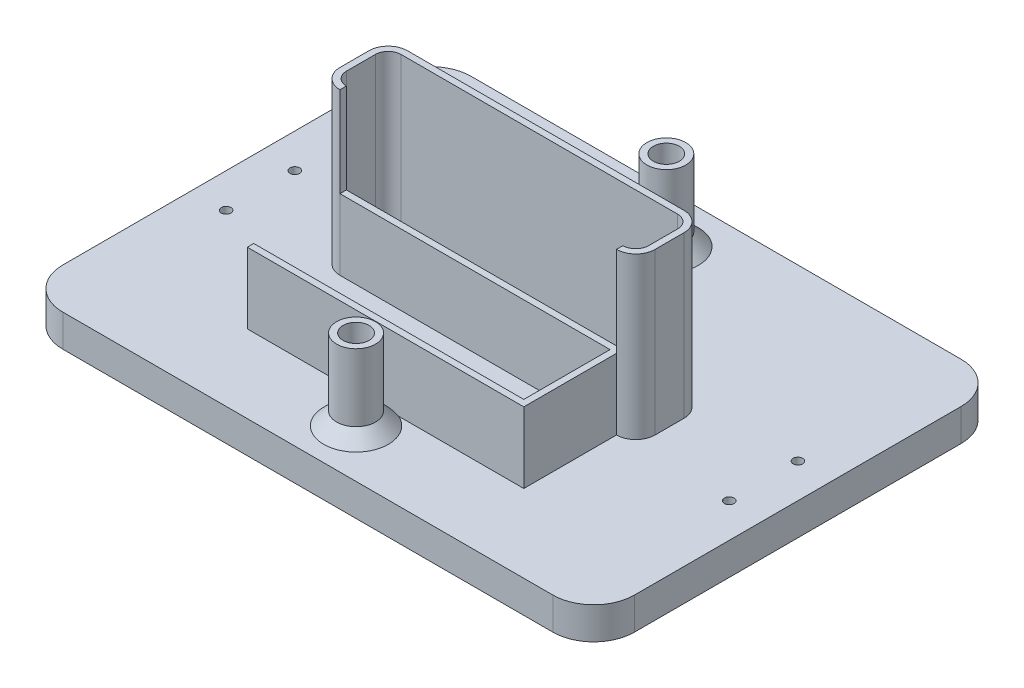
from build123d import *

# Parameters (mm, degrees)
BOSS_EXTRUDE1_DEPTH = 10
SKETCH3_R           = 6.05
SKETCH3_R_2         = 4.05
BOSS_EXTRUDE2_DEPTH = 25
SKETCH4_R           = 1.5
CUT_EXTRUDE1_DEPTH  = 113.073458053
SKETCH5_R           = 3
CUT_EXTRUDE2_DEPTH  = 4
CUT_EXTRUDE3_DEPTH  = 113.073458053
SKETCH7_W           = 85.997746486
SKETCH7_H           = 30.827207152
SKETCH7_W_2         = 81.997746486
SKETCH7_H_2         = 26.827207152
BOSS_EXTRUDE3_DEPTH = 22
SKETCH9_W           = 26.827207152
SKETCH9_H           = 22
CUT_EXTRUDE7_DEPTH  = 22
BOSS_EXTRUDE4_START = 50
BOSS_EXTRUDE4_DEPTH = 50
CUT_EXTRUDE8_DEPTH  = 22
CHAMFER2_SIZE       = 4


with BuildPart() as part:
    # Sketch2 → Boss-Extrude1 (new body)
    with BuildSketch(Plane(origin=(0, 0, 0), x_dir=(1, 0, 0), z_dir=(0, 1, 0))):
        with BuildLine():
            Line((-76.2, 63.5), (76.2, 63.5))
            ThreePointArc((76.2, 63.5), (85.180256121, 59.780256121), (88.9, 50.8))
            Line((88.9, 50.8), (88.9, -50.8))
            ThreePointArc((88.9, -50.8), (85.180256121, -59.780256121), (76.2, -63.5))
            Line((76.2, -63.5), (-76.2, -63.5))
            ThreePointArc((-76.2, -63.5), (-85.180256121, -59.780256121), (-88.9, -50.8))
            Line((-88.9, -50.8), (-88.9, 50.8))
            ThreePointArc((-88.9, 50.8), (-85.180256121, 59.780256121), (-76.2, 63.5))
        make_face()
    extrude(amount=BOSS_EXTRUDE1_DEPTH)

    # Sketch3 → Boss-Extrude2 (add)
    # profile 1 of 2: a face of its own
    with BuildSketch(Plane(origin=(0, 10, 0), x_dir=(1, 0, 0), z_dir=(0, 1, 0))):
        with Locations(Location((0, 48, 0), (0, 0, 270))):
            Circle(SKETCH3_R)
        with Locations(Location((0, 48, 0), (0, 0, 270))):
            Circle(SKETCH3_R_2, mode=Mode.SUBTRACT)
    # profile 2 of 2: a face of its own
    with BuildSketch(Plane(origin=(0, 10, 0), x_dir=(1, 0, 0), z_dir=(0, 1, 0))):
        with Locations(Location((0, -48.5, 0), (0, 0, 270))):
            Circle(SKETCH3_R)
        with Locations(Location((0, -48.5, 0), (0, 0, 270))):
            Circle(SKETCH3_R_2, mode=Mode.SUBTRACT)
    extrude(amount=BOSS_EXTRUDE2_DEPTH)

    # Sketch4 → Cut-Extrude1 (cut, through all)
    with BuildSketch(Plane(origin=(0, 10, 0), x_dir=(1, 0, 0), z_dir=(0, 1, 0))):
        with Locations(Location((-78.23, 10.69, 0), (0, 0, 270))):
            Circle(SKETCH4_R)
        with Locations(Location((-78.23, -10.69, 0), (0, 0, 270))):
            Circle(SKETCH4_R)
        with Locations(Location((78.23, -10.69, 0), (0, 0, 90))):
            Circle(SKETCH4_R)
        with Locations(Location((78.23, 10.69, 0), (0, 0, 90))):
            Circle(SKETCH4_R)
    extrude(amount=-CUT_EXTRUDE1_DEPTH, mode=Mode.SUBTRACT)

    # Sketch5 → Cut-Extrude2 (cut)
    with BuildSketch(Plane.XZ):
        with Locations(Location((-78.23, 10.69, 0), (0, 0, 270))):
            Circle(SKETCH5_R)
        with Locations(Location((-78.23, -10.69, 0), (0, 0, 270))):
            Circle(SKETCH5_R)
        with Locations(Location((78.23, 10.69, 0), (0, 0, 270))):
            Circle(SKETCH5_R)
        with Locations(Location((78.23, -10.69, 0), (0, 0, 270))):
            Circle(SKETCH5_R)
    extrude(amount=-CUT_EXTRUDE2_DEPTH, mode=Mode.SUBTRACT)

    # Sketch6 → Cut-Extrude3 (cut, through all)
    with BuildSketch(Plane(origin=(0, 10, 0), x_dir=(1, 0, 0), z_dir=(0, 1, 0))):
        with BuildLine():
            Line((-43, 8.5), (43, 8.5))
            ThreePointArc((43, 8.5), (45.828427125, 7.328427125), (47, 4.5))
            Line((47, 4.5), (47, -4.5))
            ThreePointArc((47, -4.5), (45.828427125, -7.328427125), (43, -8.5))
            Line((43, -8.5), (-43, -8.5))
            ThreePointArc((-43, -8.5), (-45.828427125, -7.328427125), (-47, -4.5))
            Line((-47, -4.5), (-47, 4.5))
            ThreePointArc((-47, 4.5), (-45.828427125, 7.328427125), (-43, 8.5))
        make_face()
    extrude(amount=-CUT_EXTRUDE3_DEPTH, mode=Mode.SUBTRACT)

    # Sketch7 → Boss-Extrude3 (add)
    with BuildSketch(Plane(origin=(0, 10, 0), x_dir=(1, 0, 0), z_dir=(0, 1, 0))):
        with Locations((-0.001126757, -23.913603576)):
            Rectangle(SKETCH7_W, SKETCH7_H)
        with Locations((-0.001126757, -23.913603576)):
            Rectangle(SKETCH7_W_2, SKETCH7_H_2, mode=Mode.SUBTRACT)
    extrude(amount=BOSS_EXTRUDE3_DEPTH)

    # Sketch9 → Cut-Extrude7 (cut)
    with BuildSketch(Plane.ZY.offset(43)):
        with Locations((23.913603576, 21)):
            Rectangle(SKETCH9_W, SKETCH9_H)
    extrude(amount=-CUT_EXTRUDE7_DEPTH, mode=Mode.SUBTRACT)

    # Sketch10 → Boss-Extrude4 (add)
    with BuildSketch(Plane(origin=(0, 10, 0), x_dir=(1, 0, 0), z_dir=(0, 1, 0)).offset(BOSS_EXTRUDE4_START)):
        with BuildLine():
            Line((-49, 4.5), (-49, -4.5))
            ThreePointArc((-49, -4.5), (-47.242640687, -8.742640687), (-43, -10.5))
            Line((-43, -10.5), (-43, -8.5))
            ThreePointArc((-43, -8.5), (-45.828427125, -7.328427125), (-47, -4.5))
            Line((-47, -4.5), (-47, 4.5))
            ThreePointArc((-47, 4.5), (-45.828427125, 7.328427125), (-43, 8.5))
            Line((-43, 8.5), (43, 8.5))
            ThreePointArc((43, 8.5), (45.828427125, 7.328427125), (47, 4.5))
            Line((47, 4.5), (47, -4.5))
            ThreePointArc((47, -4.5), (45.828427125, -7.328427125), (43, -8.5))
            Line((43, -8.5), (43, -10.5))
            ThreePointArc((43, -10.5), (47.242640687, -8.742640687), (49, -4.5))
            Line((49, -4.5), (49, 4.5))
            ThreePointArc((49, 4.5), (47.242640687, 8.742640687), (43, 10.5))
            Line((43, 10.5), (-43, 10.5))
            ThreePointArc((-43, 10.5), (-47.242640687, 8.742640687), (-49, 4.5))
        make_face()
    extrude(amount=-BOSS_EXTRUDE4_DEPTH)

    # Sketch11 → Cut-Extrude8 (cut)
    with BuildSketch(Plane.XZ):
        with BuildLine():
            Line((-17.302391978, 25.904152562), (17.302391978, 25.904152562))
            ThreePointArc((17.302391978, 25.904152562), (19.873033072, 23.333511468), (17.302391978, 20.762870374))
            Line((17.302391978, 20.762870374), (-17.302391978, 20.762870374))
            ThreePointArc((-17.302391978, 20.762870374), (-19.873033072, 23.333511468), (-17.302391978, 25.904152562))
        make_face()
    extrude(amount=-CUT_EXTRUDE8_DEPTH, mode=Mode.SUBTRACT)

    # Chamfer2
    # the kernel refuses this chamfer: 4 mm, written as the material it adds along each edge
    with BuildSketch(Plane(origin=(0, 10, -48), x_dir=(0, 0, 1), z_dir=(-1, 0, 0))) as chamfer2_piece_1:
        Polygon((6.05 + CHAMFER2_SIZE, 0), (6.05, CHAMFER2_SIZE), (6.05, 0), align=None)
    revolve(axis=Axis((0, 10, -48), (0, 1, 0)))
    with BuildSketch(Plane(origin=(0, 10, 48.5), x_dir=(0, 0, 1), z_dir=(-1, 0, 0))) as chamfer2_piece_2:
        Polygon((6.05 + CHAMFER2_SIZE, 0), (6.05, CHAMFER2_SIZE), (6.05, 0), align=None)
    revolve(axis=Axis((0, 10, 48.5), (0, 1, 0)))


solid = part.part
